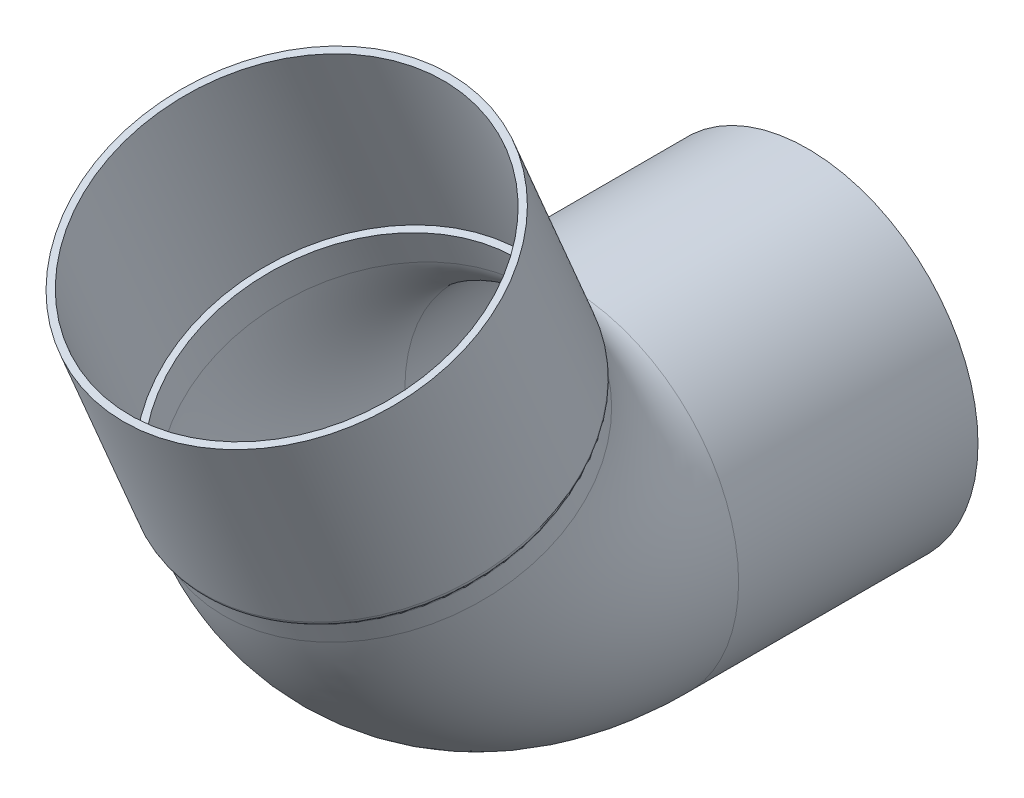
from build123d import *

# Parameters (mm, degrees)
ESQUISSE6_R        = 25
ESQUISSE6_R_2      = 24
ESQUISSE8_R        = 26
ESQUISSE8_R_2      = 24
EXTRU_MINCE1_DEPTH = 1
EXTRU_MINCE2_START = 30
ESQUISSE9_R        = 26
ESQUISSE9_R_2      = 25
EXTRU_MINCE2_DEPTH = 30
CONG_1_R           = 1
CONG_2_R           = 1


with BuildPart() as part:
    # Balayage-Mince2: sweep along a path in Esquisse7
    with BuildLine(Plane(origin=(0, 0, 0), x_dir=(0, 0, -1), z_dir=(1, 0, 0))) as balayage_mince2_path:
        Line((0, 0), (-35.14343316412919, -3.47e-15))
        ThreePointArc((-35.14343316412919, -3.47e-15), (-51.70154272349097, 4.983425337984965), (-62.75857876770245, 18.27806614532184))
        Line((-62.75857876770245, 18.27806614532184), (-64.37754708374251, 22.092116482858586))
    # Esquisse6 → Balayage-Mince2 (sweep)
    with BuildSketch(Plane.XY):
        Circle(ESQUISSE6_R)
        Circle(ESQUISSE6_R_2, mode=Mode.SUBTRACT)
    sweep(path=balayage_mince2_path.line)



with BuildPart() as body_2:
    # Esquisse8 → Extru.-Mince1 (new body)
    with BuildSketch(Plane(origin=(0, 41.87396099217143, 17.77444189612002), x_dir=(1, 0, 0), z_dir=(0, 0.9205048534524412, 0.39073112848927183))):
        with Locations((0, -50.62776693988426)):
            Circle(ESQUISSE8_R)
        with Locations((0, -50.62776693988426)):
            Circle(ESQUISSE8_R_2, mode=Mode.SUBTRACT)
    extrude(amount=EXTRU_MINCE1_DEPTH)


with BuildPart() as part_1:
    add(part.part)

    add(body_2.part)  # Extru.-Mince2 merges body 2
    # Esquisse9 → Extru.-Mince2 (add)
    with BuildSketch(Plane(origin=(0, 42.794465845623876, 18.16517302460929), x_dir=(1, 0, 0), z_dir=(0, 0.9205048534524412, 0.39073112848927183)).offset(EXTRU_MINCE2_START)):
        with Locations((0, -50.627766939884246)):
            Circle(ESQUISSE9_R)
        with Locations((0, -50.627766939884246)):
            Circle(ESQUISSE9_R_2, mode=Mode.SUBTRACT)
    extrude(amount=-EXTRU_MINCE2_DEPTH)

    # Congé1
    cong_1_edges = [part_1.edges().sort_by_distance(p)[0] for p in [
        (-25, 22.09211648285859, 64.3775470837425),
    ]]
    fillet(cong_1_edges, radius=CONG_1_R - 0.0001)  # a hair under: the kernel refuses the full size

    # Congé2
    cong_2_edges = [part_1.edges().sort_by_distance(p)[0] for p in [
        (-26, 22.092116482858604, 64.37754708374253),
    ]]
    fillet(cong_2_edges, radius=CONG_2_R)


solid = part_1.part
